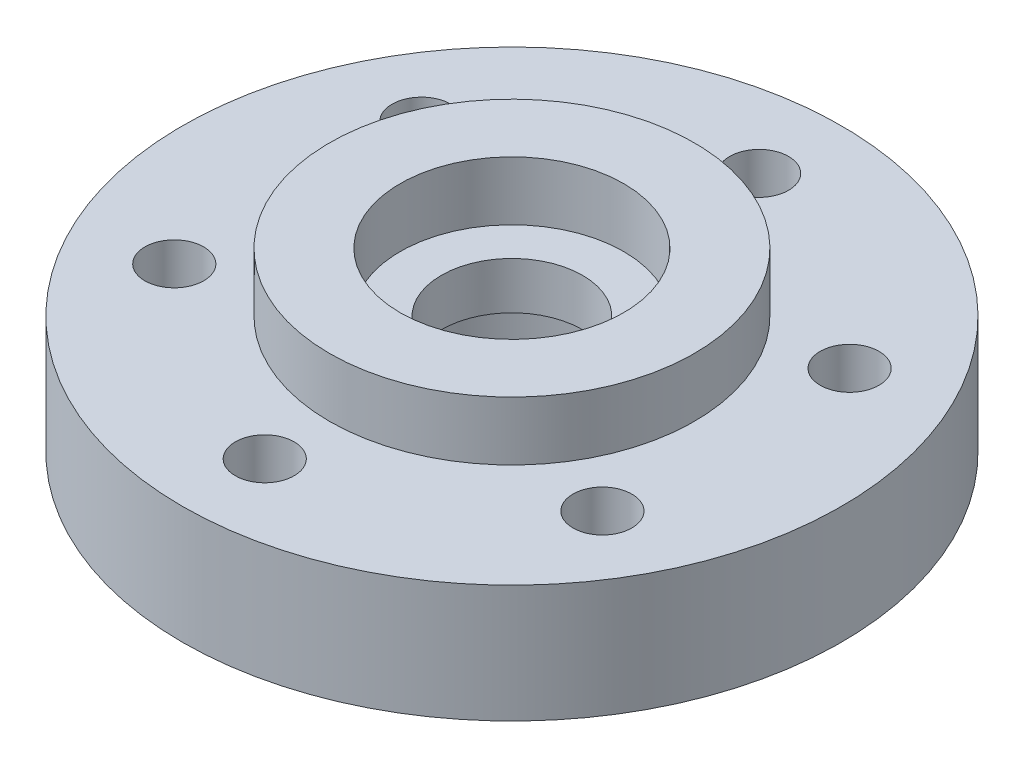
from build123d import *

# Parameters (mm, degrees)
SKETCH1_R           = 28
SKETCH1_R_2         = 2.5
SKETCH1_R_3         = 6
BOSS_EXTRUDE1_DEPTH = 10
SKETCH2_R           = 15.5
SKETCH2_R_2         = 9.5
BOSS_EXTRUDE2_DEPTH = 5
SKETCH3_R           = 11
CUT_EXTRUDE1_DEPTH  = 6


with BuildPart() as part:
    # Sketch1 → Boss-Extrude1 (new body)
    with BuildSketch(Plane(origin=(0, 0, 0), x_dir=(1, 0, 0), z_dir=(0, 1, 0))):
        Circle(SKETCH1_R)
        with Locations((0, 21)):
            Circle(SKETCH1_R_2, mode=Mode.SUBTRACT)
        with Locations((18.186533479, 10.5)):
            Circle(SKETCH1_R_2, mode=Mode.SUBTRACT)
        with Locations((18.186533479, -10.5)):
            Circle(SKETCH1_R_2, mode=Mode.SUBTRACT)
        with Locations((0, -21)):
            Circle(SKETCH1_R_2, mode=Mode.SUBTRACT)
        with Locations((-18.186533479, -10.5)):
            Circle(SKETCH1_R_2, mode=Mode.SUBTRACT)
        with Locations((-18.186533479, 10.5)):
            Circle(SKETCH1_R_2, mode=Mode.SUBTRACT)
        Circle(SKETCH1_R_3, mode=Mode.SUBTRACT)
    extrude(amount=BOSS_EXTRUDE1_DEPTH)

    # Sketch2 → Boss-Extrude2 (add)
    with BuildSketch(Plane(origin=(0, 10, 0), x_dir=(1, 0, 0), z_dir=(0, 1, 0))):
        Circle(SKETCH2_R)
        Circle(SKETCH2_R_2, mode=Mode.SUBTRACT)
    extrude(amount=BOSS_EXTRUDE2_DEPTH)

    # Sketch3 → Cut-Extrude1 (cut)
    with BuildSketch(Plane.XZ):
        Circle(SKETCH3_R)
    extrude(amount=-CUT_EXTRUDE1_DEPTH, mode=Mode.SUBTRACT)


solid = part.part
